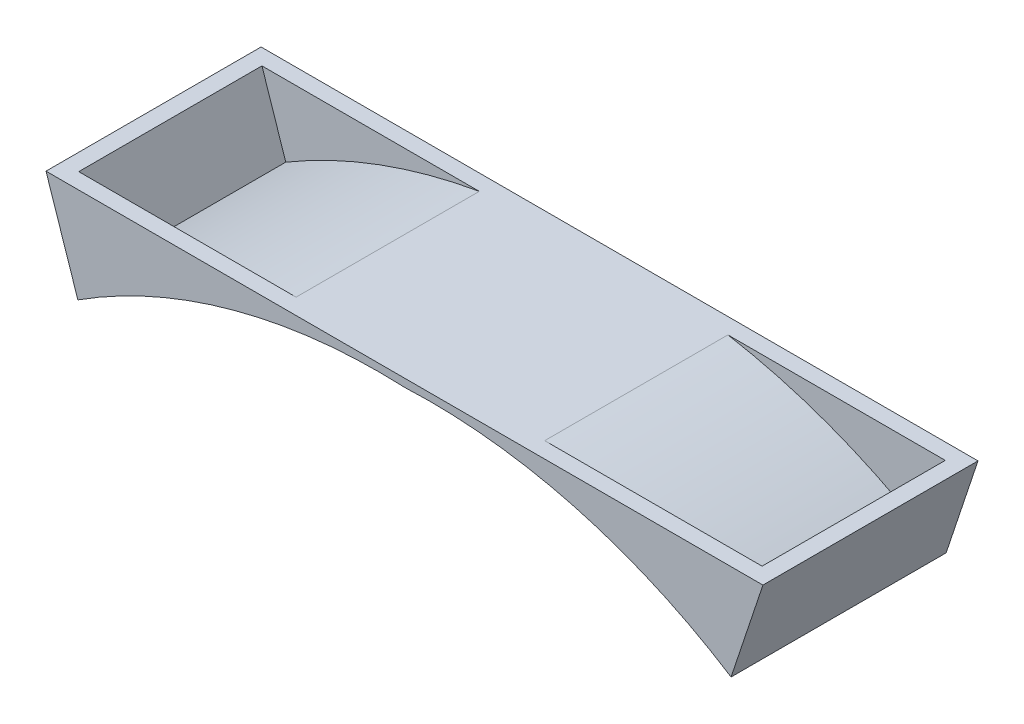
from build123d import *

# Parameters (mm, degrees)
BOSS_EXTRUDE1_DEPTH = 27
SHELL1_START        = 2
SHELL1_DEPTH        = 23


# Read off the part's stored shape, not the designer's step: Shell1
with BuildPart() as part:
    # Sketch1 → Boss-Extrude1 (new body)
    with BuildSketch(Plane.XY):
        with BuildLine():
            Line((45, 0), (-45, 0))
            Line((-45, 0), (-41, -12))
            ThreePointArc((-41, -12), (-21.353939388, -3.317135008), (0, -1))
            ThreePointArc((0, -1), (21.353939388, -3.317135008), (41, -12))
            Line((41, -12), (45, 0))
        make_face()
    extrude(amount=BOSS_EXTRUDE1_DEPTH)

    # Shell1 outline → Shell1 (cut)
    with BuildSketch(Plane.XY.offset(SHELL1_START)):
        with BuildLine():
            Line((-42.891814893, 0), (-39.90071559, -8.97329791))
            ThreePointArc((-39.90071559, -8.97329791), (-28.159071544, -3.3851069), (-15.603788395, 0))
            Line((-15.603788395, 0), (-42.891814893, 0))
        make_face()
        with BuildLine():
            Line((42.891814893, 0), (15.603788395, 0))
            ThreePointArc((15.603788395, 0), (28.159071544, -3.3851069), (39.90071559, -8.97329791))
            Line((39.90071559, -8.97329791), (42.891814893, 0))
        make_face()
    extrude(amount=SHELL1_DEPTH, mode=Mode.SUBTRACT)


solid = part.part
